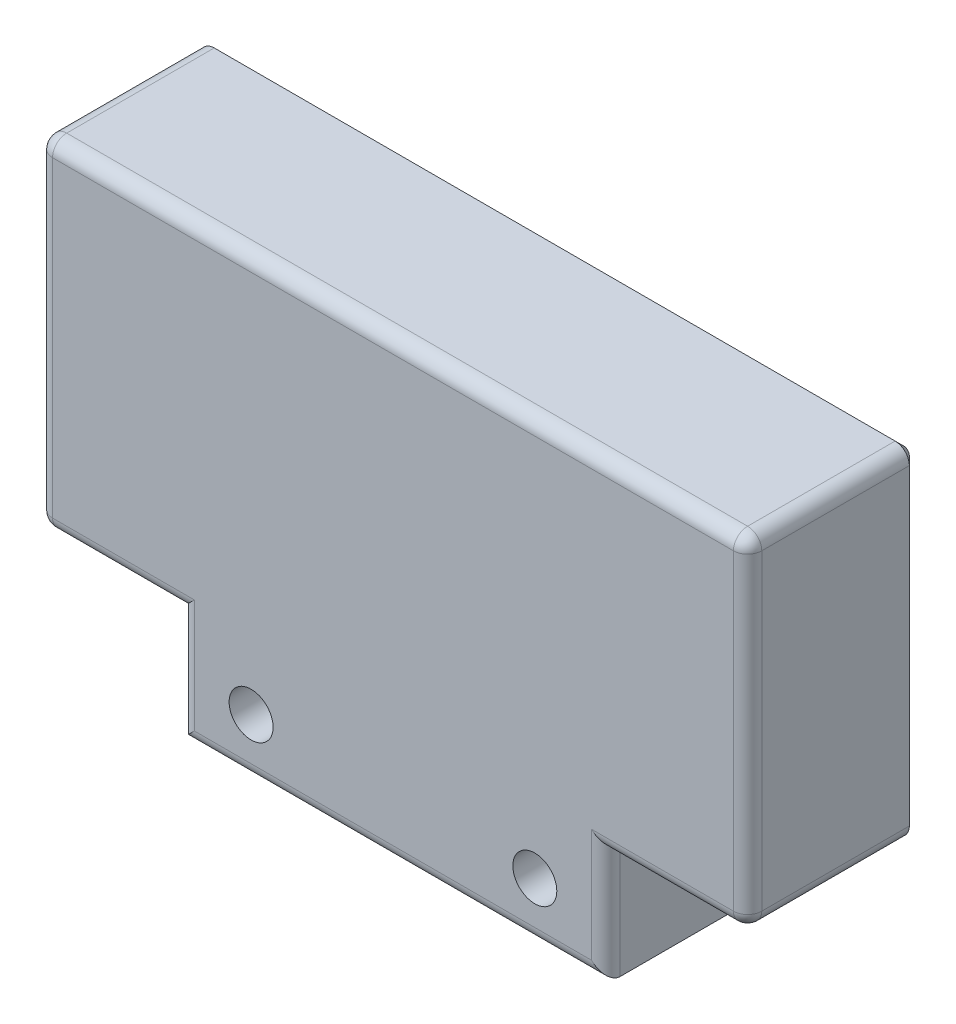
from build123d import *

# Parameters (mm, degrees)
SKETCH1_W           = 30
SKETCH1_H           = 8
SKETCH1_R           = 1.55
BOSS_EXTRUDE1_DEPTH = 6
SKETCH6_W           = 50
SKETCH6_H           = 24
BOSS_EXTRUDE4_DEPTH = 12
SKETCH8_W           = 11
SKETCH8_H           = 8
CUT_EXTRUDE2_DEPTH  = 8
FILLET1_R           = 1
FILLET2_R           = 1
CHAMFER2_SIZE       = 0.6
CHAMFER3_SIZE       = 0.5


with BuildPart() as part:
    # Sketch1 → Boss-Extrude1 (new, symmetric)
    with BuildSketch(Plane.XY):
        Rectangle(SKETCH1_W, SKETCH1_H)
        with Locations((10, 0)):
            Circle(SKETCH1_R, mode=Mode.SUBTRACT)
        with Locations(Location((-10, 0, 0), (0, 0, 180))):
            Circle(SKETCH1_R, mode=Mode.SUBTRACT)
    extrude(amount=BOSS_EXTRUDE1_DEPTH, both=True)

    # Sketch6 → Boss-Extrude4 (add)
    with BuildSketch(Plane(origin=(0, 0, -6), x_dir=(-1, 0, 0), z_dir=(0, 0, -1))):
        with Locations((0, 16)):
            Rectangle(SKETCH6_W, SKETCH6_H)
    extrude(amount=-BOSS_EXTRUDE4_DEPTH)

    # Sketch8 → Cut-Extrude2 (cut)
    with BuildSketch(Plane(origin=(0, 0, -6), x_dir=(-1, 0, 0), z_dir=(0, 0, -1))):
        Rectangle(SKETCH8_W, SKETCH8_H)
        Polygon((-23, 25), (-23, 4), (-15, 4), (-5.5, 4), (5.5, 4), (15, 4), (23, 4), (23, 25), align=None)
    extrude(amount=-CUT_EXTRUDE2_DEPTH, mode=Mode.SUBTRACT)

    # Fillet1
    fillet1_edges = [part.edges().sort_by_distance(p)[0] for p in [
        (25, 16, 6),
        (0, 28, 6),
        (-25, 16, 6),
    ]]
    fillet(fillet1_edges, radius=FILLET1_R)

    # Fillet2
    # the kernel refuses this fillet: 1 mm, written as the material it takes off along each edge
    with BuildSketch(Plane(origin=(24, 27, 5), x_dir=(0, 1, 0), z_dir=(1, 0, 0))) as fillet2_piece_1_section:
        Polygon((0, 0), (FILLET2_R, 0), (FILLET2_R, FILLET2_R), (0, FILLET2_R), align=None)
    fillet2_piece_1 = extrude(amount=FILLET2_R, mode=Mode.PRIVATE)
    fillet2_piece_1 = fillet2_piece_1 - Plane(origin=(24, 27, 5), x_dir=(0, -0.7071067811865475, -0.7071067811865475), z_dir=(1, 0, 0)) * Sphere(FILLET2_R, mode=Mode.PRIVATE)
    add(fillet2_piece_1, mode=Mode.SUBTRACT)
    with BuildSketch(Plane(origin=(-24, 27, 5), x_dir=(-1, 0, 0), z_dir=(0, 1, 0))) as fillet2_piece_2_section:
        Polygon((0, 0), (FILLET2_R, 0), (FILLET2_R, FILLET2_R), (0, FILLET2_R), align=None)
    fillet2_piece_2 = extrude(amount=FILLET2_R, mode=Mode.PRIVATE)
    fillet2_piece_2 = fillet2_piece_2 - Plane(origin=(-24, 27, 5), x_dir=(0.7071067811865475, 0, -0.7071067811865475), z_dir=(0, 1, 0)) * Sphere(FILLET2_R, mode=Mode.PRIVATE)
    add(fillet2_piece_2, mode=Mode.SUBTRACT)
    with BuildSketch(Plane(origin=(-15, 4, 6), x_dir=(1, 0, 0), z_dir=(0, -1, 0)), Plane(origin=(15, -6.5, 6), x_dir=(-1, 0, 0), z_dir=(0, 1, 0))) as fillet2_piece_3:
        with BuildLine():
            CenterArc((FILLET2_R, -FILLET2_R), FILLET2_R, 90, 90)
            Line((0, -FILLET2_R), (0, 0))
            Line((0, 0), (FILLET2_R, 0))
        make_face()
    extrude(amount=10.5, mode=Mode.SUBTRACT)
    with BuildSketch(Plane(origin=(-17.5, -4, 6), x_dir=(0, 1, 0), z_dir=(1, 0, 0))) as fillet2_piece_4:
        with BuildLine():
            CenterArc((FILLET2_R, -FILLET2_R), FILLET2_R, 90, 90)
            Line((0, -FILLET2_R), (0, 0))
            Line((0, 0), (FILLET2_R, 0))
        make_face()
    extrude(amount=35, mode=Mode.SUBTRACT)
    with BuildSketch(Plane(origin=(24, 4, 6), x_dir=(0, 0, -1), z_dir=(-1, 0, 0))) as fillet2_piece_5:
        with BuildLine():
            CenterArc((FILLET2_R, -FILLET2_R), FILLET2_R, 90, 90)
            Line((0, -FILLET2_R), (0, 0))
            Line((0, 0), (FILLET2_R, 0))
        make_face()
    extrude(amount=9, mode=Mode.SUBTRACT)
    with BuildSketch(Plane(origin=(-15, 4, 6), x_dir=(0, 1, 0), z_dir=(-1, 0, 0))) as fillet2_piece_6:
        with BuildLine():
            CenterArc((FILLET2_R, FILLET2_R), FILLET2_R, 180, 90)
            Line((0, FILLET2_R), (0, 0))
            Line((0, 0), (FILLET2_R, 0))
        make_face()
    extrude(amount=9, mode=Mode.SUBTRACT)
    with BuildSketch(Plane(origin=(-25, 4, -8.5), x_dir=(1, 0, 0), z_dir=(0, 0, 1))) as fillet2_piece_7:
        with BuildLine():
            CenterArc((FILLET2_R, FILLET2_R), FILLET2_R, 180, 90)
            Line((0, FILLET2_R), (0, 0))
            Line((0, 0), (FILLET2_R, 0))
        make_face()
    extrude(amount=13.5, mode=Mode.SUBTRACT)
    with BuildSketch(Plane(origin=(-24, 4, 5), x_dir=(0, 0, 1), z_dir=(1, 0, 0))) as fillet2_piece_8:
        with BuildLine():
            CenterArc((1 - FILLET2_R, -FILLET2_R), FILLET2_R, 0, 90)
            Line((1 - FILLET2_R, 0), (1, 0))
            Line((1, 0), (1, -FILLET2_R))
        make_face()
    revolve(axis=Axis((-24, 4, 5), (0, -1, 0)), revolution_arc=90, mode=Mode.SUBTRACT)
    with BuildSketch(Plane(origin=(-25, 28, -8.5), x_dir=(1, 0, 0), z_dir=(0, 0, 1)), Plane(origin=(25, 4, -8.5), x_dir=(-1, 0, 0), z_dir=(0, 0, 1)), Plane(origin=(25, 28, -8.5), x_dir=(0, -1, 0), z_dir=(0, 0, 1))) as fillet2_piece_9:
        with BuildLine():
            CenterArc((FILLET2_R, -FILLET2_R), FILLET2_R, 90, 90)
            Line((0, -FILLET2_R), (0, 0))
            Line((0, 0), (FILLET2_R, 0))
        make_face()
    extrude(amount=13.5, mode=Mode.SUBTRACT)
    with BuildSketch(Plane(origin=(24, 4, 5), x_dir=(0, 0, 1), z_dir=(-1, 0, 0))) as fillet2_piece_10:
        with BuildLine():
            CenterArc((1 - FILLET2_R, FILLET2_R), FILLET2_R, 270, 90)
            Line((1, FILLET2_R), (1, 0))
            Line((1, 0), (1 - FILLET2_R, 0))
        make_face()
    revolve(axis=Axis((24, 4, 5), (0, 1, 0)), revolution_arc=90, mode=Mode.SUBTRACT)
    with BuildSketch(Plane(origin=(-15, 6.5, 6), x_dir=(1, 0, 0), z_dir=(0, -1, 0))) as fillet2_piece_11a_section:
        with BuildLine():
            CenterArc((FILLET2_R, -FILLET2_R), FILLET2_R, 90, 90)
            Line((0, -FILLET2_R), (0, 0))
            Line((0, 0), (FILLET2_R, 0))
        make_face()
    fillet2_piece_11a = extrude(amount=13, mode=Mode.PRIVATE)
    fillet2_piece_11a = split(fillet2_piece_11a, bisect_by=Plane(origin=(-14.773604886, 4, 5.773604886), z_dir=(0, 1, 0)), keep=Keep.TOP, mode=Mode.PRIVATE)
    with BuildSketch(Plane(origin=(-12.5, 4, 6), x_dir=(0, 1, 0), z_dir=(-1, 0, 0))) as fillet2_piece_11b_section:
        with BuildLine():
            CenterArc((FILLET2_R, FILLET2_R), FILLET2_R, 180, 90)
            Line((0, FILLET2_R), (0, 0))
            Line((0, 0), (FILLET2_R, 0))
        make_face()
    fillet2_piece_11b = extrude(amount=11.5, mode=Mode.PRIVATE)
    fillet2_piece_11b = split(fillet2_piece_11b, bisect_by=Plane(origin=(-15, 4.226395114, 5.773604886), z_dir=(1, 0, 0)), keep=Keep.TOP, mode=Mode.PRIVATE)
    fillet2_piece_11 = fillet2_piece_11a & fillet2_piece_11b
    add(fillet2_piece_11, mode=Mode.SUBTRACT)
    with BuildSketch(Plane(origin=(24, 4, 6), x_dir=(0, 0, -1), z_dir=(-1, 0, 0))) as fillet2_piece_12a_section:
        with BuildLine():
            CenterArc((FILLET2_R, -FILLET2_R), FILLET2_R, 90, 90)
            Line((0, -FILLET2_R), (0, 0))
            Line((0, 0), (FILLET2_R, 0))
        make_face()
    fillet2_piece_12a = extrude(amount=11.5, mode=Mode.PRIVATE)
    fillet2_piece_12a = split(fillet2_piece_12a, bisect_by=Plane(origin=(15, 4.226395114, 5.773604886), z_dir=(-1, 0, 0)), keep=Keep.TOP, mode=Mode.PRIVATE)
    with BuildSketch(Plane(origin=(15, -6.5, 6), x_dir=(-1, 0, 0), z_dir=(0, 1, 0))) as fillet2_piece_12b_section:
        with BuildLine():
            CenterArc((FILLET2_R, -FILLET2_R), FILLET2_R, 90, 90)
            Line((0, -FILLET2_R), (0, 0))
            Line((0, 0), (FILLET2_R, 0))
        make_face()
    fillet2_piece_12b = extrude(amount=13, mode=Mode.PRIVATE)
    fillet2_piece_12b = split(fillet2_piece_12b, bisect_by=Plane(origin=(14.773604886, 4, 5.773604886), z_dir=(0, 1, 0)), keep=Keep.TOP, mode=Mode.PRIVATE)
    fillet2_piece_12 = fillet2_piece_12a & fillet2_piece_12b
    add(fillet2_piece_12, mode=Mode.SUBTRACT)

    # Chamfer2
    chamfer2_edges = [part.edges().sort_by_distance(p)[0] for p in [
        (-25, 16, -6),
        (0, 28, -6),
        (25, 16, -6),
        (24.707106781, 27.707106781, -6),
        (-24.707106781, 27.707106781, -6),
        (24.707106781, 4.292893219, -6),
        (-24.707106781, 4.292893219, -6),
        (-23.5, 4, -6),
        (23.5, 4, -6),
    ]]
    chamfer(chamfer2_edges, length=CHAMFER2_SIZE)

    # Chamfer3
    chamfer3_edges = [part.edges().sort_by_distance(p)[0] for p in [
        (8.45, 0, -6),
        (-8.45, 0, -6),
        (10.25, -4, -6),
        (-5.5, 0, -6),
        (-10.25, -4, -6),
        (-15, 0, -6),
        (-10.25, 4, -6),
        (10.25, 4, -6),
        (5.5, 0, -6),
        (15, 0, -6),
    ]]
    chamfer(chamfer3_edges, length=CHAMFER3_SIZE)


solid = part.part
